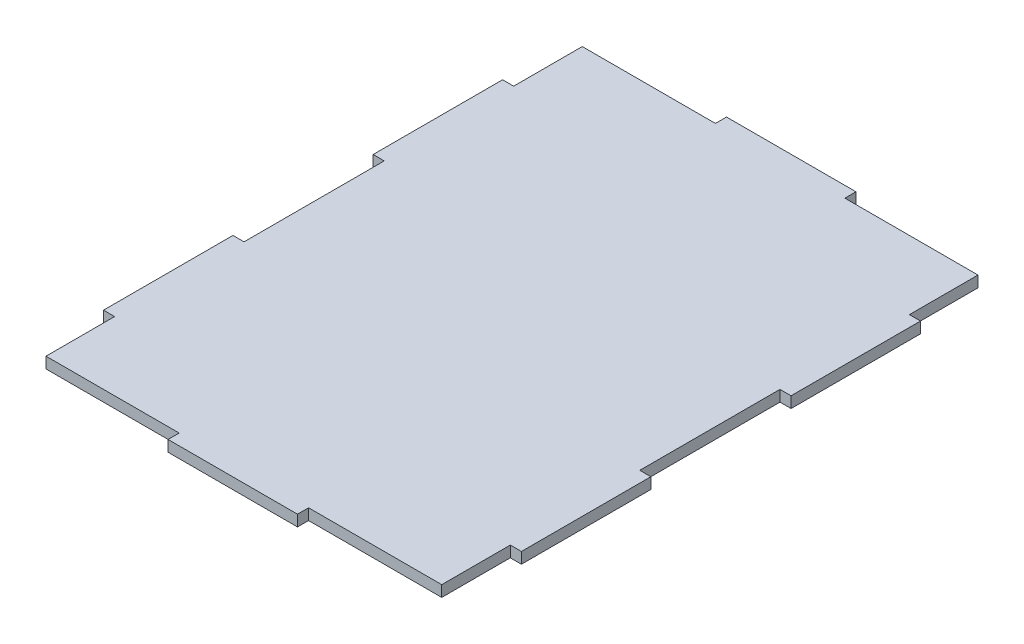
from build123d import *

# Parameters (mm, degrees)
SKETCH1_W           = 107
SKETCH1_H           = 145
BOSS_EXTRUDE1_DEPTH = 3
SKETCH3_W           = 35
SKETCH3_H           = 3
BOSS_EXTRUDE4_DEPTH = 3
SKETCH4_W           = 35
SKETCH4_H           = 3
BOSS_EXTRUDE5_DEPTH = 3
SKETCH5_W           = 35
SKETCH5_H           = 3
BOSS_EXTRUDE6_DEPTH = 3
SKETCH6_W           = 35
SKETCH6_H           = 3
BOSS_EXTRUDE7_DEPTH = 3


with BuildPart() as part:
    # Sketch1 → Boss-Extrude1 (new body)
    with BuildSketch(Plane(origin=(0, 0, 0), x_dir=(1, 0, 0), z_dir=(0, 1, 0))):
        Rectangle(SKETCH1_W, SKETCH1_H)
    extrude(amount=BOSS_EXTRUDE1_DEPTH)

    # Sketch3 → Boss-Extrude4 (add)
    with BuildSketch(Plane(origin=(53.5, 0, 0), x_dir=(0, 0, -1), z_dir=(1, 0, 0))):
        with Locations((36.453510912, 1.5)):
            Rectangle(SKETCH3_W, SKETCH3_H)
        with Locations((-36.453510912, 1.5)):
            Rectangle(SKETCH3_W, SKETCH3_H)
    extrude(amount=BOSS_EXTRUDE4_DEPTH)

    # Sketch4 → Boss-Extrude5 (add)
    with BuildSketch(Plane.ZY.offset(53.5)):
        with Locations((-36.45, 1.5)):
            Rectangle(SKETCH4_W, SKETCH4_H)
        with Locations((36.45, 1.5)):
            Rectangle(SKETCH4_W, SKETCH4_H)
    extrude(amount=BOSS_EXTRUDE5_DEPTH)

    # Sketch5 → Boss-Extrude6 (add)
    with BuildSketch(Plane.XY.offset(72.5)):
        with Locations((0, 1.5)):
            Rectangle(SKETCH5_W, SKETCH5_H)
    extrude(amount=BOSS_EXTRUDE6_DEPTH)

    # Sketch6 → Boss-Extrude7 (add)
    with BuildSketch(Plane(origin=(0, 0, -72.5), x_dir=(-1, 0, 0), z_dir=(0, 0, -1))):
        with Locations((0, 1.5)):
            Rectangle(SKETCH6_W, SKETCH6_H)
    extrude(amount=BOSS_EXTRUDE7_DEPTH)


solid = part.part
